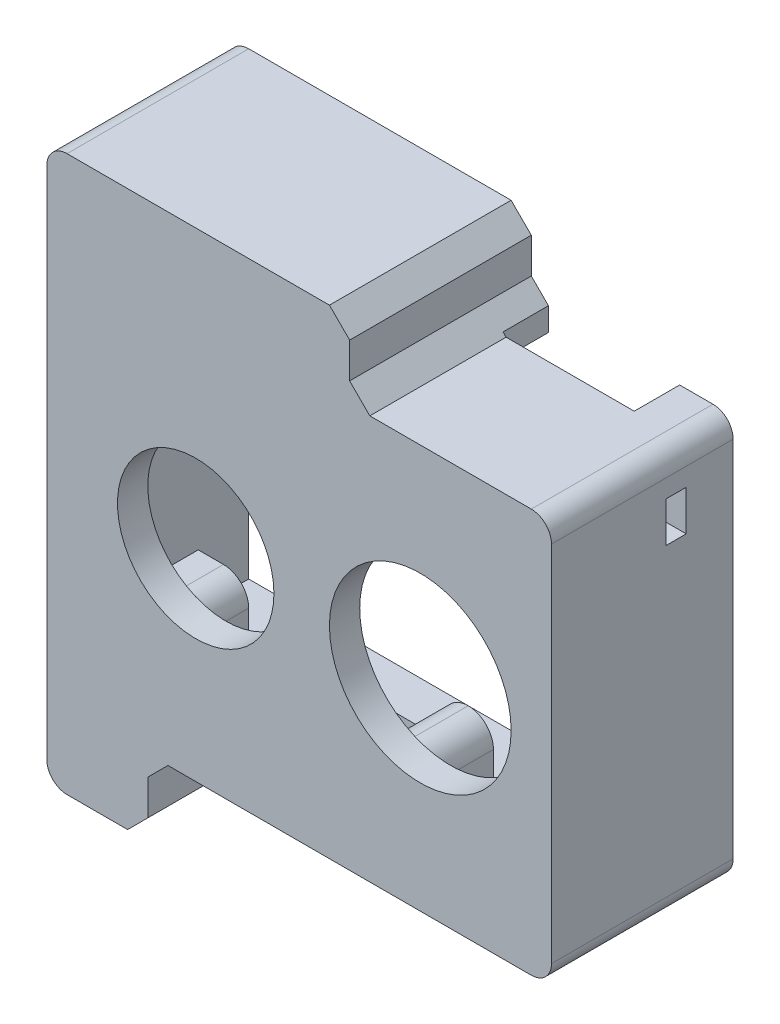
from build123d import *

# Parameters (mm, degrees)
SKETCH1_W           = 46
SKETCH1_H           = 36
BOSS_EXTRUDE1_DEPTH = 15
BOSS_EXTRUDE2_DEPTH = 3
SKETCH3_R           = 7.75
SKETCH3_R_2         = 9
CUT_EXTRUDE1_DEPTH  = 10
SKETCH4_W           = 5
SKETCH4_H           = 5
SKETCH4_R           = 1
BOSS_EXTRUDE3_DEPTH = 10
FILLET1_R           = 2.5
SKETCH6_R           = 1
CUT_EXTRUDE2_DEPTH  = 10
CHAMFER1_SIZE       = 2
FILLET2_R           = 2
SKETCH7_W           = 13
SKETCH7_H           = 4.5
CUT_EXTRUDE3_DEPTH  = 10
SKETCH8_W           = 9
SKETCH8_H           = 4
CUT_EXTRUDE4_DEPTH  = 10
SKETCH9_W           = 2
SKETCH9_H           = 4
CUT_EXTRUDE5_DEPTH  = 10


with BuildPart() as part:
    # Sketch1 → Boss-Extrude1 (new body)
    with BuildSketch(Plane.XY):
        Polygon((-15, -27.5), (-15, -20), (25, -20), (25, 20), (5, 20), (5, 27.5), (-25, 27.5), (-25, -27.5), align=None)
        Rectangle(SKETCH1_W, SKETCH1_H, mode=Mode.SUBTRACT)
    extrude(amount=BOSS_EXTRUDE1_DEPTH)

    # Sketch2 → Boss-Extrude2 (add)
    with BuildSketch(Plane.XY.offset(15)):
        Polygon((-25, 27.5), (-25, -27.5), (-15, -27.5), (-15, -20), (25, -20), (25, 20), (5, 20), (5, 27.5), align=None)
    extrude(amount=BOSS_EXTRUDE2_DEPTH)

    # Sketch3 → Cut-Extrude1 (cut)
    with BuildSketch(Plane.XY.offset(18)):
        with Locations((-10.25, 0)):
            Circle(SKETCH3_R)
        with Locations((12, 0)):
            Circle(SKETCH3_R_2)
    extrude(amount=-CUT_EXTRUDE1_DEPTH, mode=Mode.SUBTRACT)

    # Sketch4 → Boss-Extrude3 (add)
    # profile 1 of 4: a face of its own
    with BuildSketch(Plane(origin=(0, 0, 15), x_dir=(-1, 0, 0), z_dir=(0, 0, -1))):
        with Locations((20.5, -15.5)):
            Rectangle(SKETCH4_W, SKETCH4_H)
        with Locations((20.252039878, -15.196246514)):
            Circle(SKETCH4_R, mode=Mode.SUBTRACT)
    # profile 2 of 4: a face of its own
    with BuildSketch(Plane(origin=(0, 0, 15), x_dir=(-1, 0, 0), z_dir=(0, 0, -1))):
        with Locations((-3.747960122, -15.5)):
            Rectangle(SKETCH4_W, SKETCH4_H)
        with Locations((-3.747960122, -15.196246514)):
            Circle(SKETCH4_R, mode=Mode.SUBTRACT)
    # profile 3 of 4: a face of its own
    with BuildSketch(Plane(origin=(0, 0, 15), x_dir=(-1, 0, 0), z_dir=(0, 0, -1))):
        with Locations((-3.747960122, 15.5)):
            Rectangle(SKETCH4_W, SKETCH4_H)
        with Locations((-3.747960122, 15.203753486)):
            Circle(SKETCH4_R, mode=Mode.SUBTRACT)
    # profile 4 of 4: a face of its own
    with BuildSketch(Plane(origin=(0, 0, 15), x_dir=(-1, 0, 0), z_dir=(0, 0, -1))):
        with Locations((20.5, 15.5)):
            Rectangle(SKETCH4_W, SKETCH4_H)
        with Locations((20.252039878, 15.203753486)):
            Circle(SKETCH4_R, mode=Mode.SUBTRACT)
    extrude(amount=BOSS_EXTRUDE3_DEPTH)

    # Fillet1
    fillet1_edges = [part.edges().sort_by_distance(p)[0] for p in [
        (1.247960122, 13, 10),
        (6.247960122, 13, 10),
        (-18, 13, 10),
        (-18, -13, 10),
        (1.247960122, -13, 10),
        (6.247960122, -13, 10),
    ]]
    fillet(fillet1_edges, radius=FILLET1_R - 0.0001)  # a hair under: the kernel refuses the full size

    # Sketch6 → Cut-Extrude2 (cut)
    with BuildSketch(Plane(origin=(0, 0, -3), x_dir=(-1, 0, 0), z_dir=(0, 0, -1))):
        with Locations((0, 22.5)):
            Circle(SKETCH6_R)
        with Locations((20, 22.5)):
            Circle(SKETCH6_R)
        with Locations((20, -22.5)):
            Circle(SKETCH6_R)
    extrude(amount=-CUT_EXTRUDE2_DEPTH, mode=Mode.SUBTRACT)

    # Chamfer1
    chamfer1_edges = [part.edges().sort_by_distance(p)[0] for p in [
        (5, 27.5, 9),
        (5, 20, 9),
        (-15, -20, 9),
        (-15, -27.5, 9),
    ]]
    chamfer(chamfer1_edges, length=CHAMFER1_SIZE)

    # Fillet2
    fillet2_edges = [part.edges().sort_by_distance(p)[0] for p in [
        (-25, 27.5, 9),
        (25, 20, 9),
        (25, -20, 9),
        (-25, -27.5, 9),
    ]]
    fillet(fillet2_edges, radius=FILLET2_R)

    # Sketch7 → Cut-Extrude3 (cut)
    with BuildSketch(Plane.XZ.offset(-18)):
        with Locations((13.2, 2.25)):
            Rectangle(SKETCH7_W, SKETCH7_H)
    extrude(amount=-CUT_EXTRUDE3_DEPTH, mode=Mode.SUBTRACT)

    # Sketch8 → Cut-Extrude4 (cut)
    with BuildSketch(Plane(origin=(0, -18, 0), x_dir=(1, 0, 0), z_dir=(0, 1, 0))):
        Polygon((22.2, 0), (9.2, 0), (9.2, -4.5), (11.7, -4.5), (11.7, -9.5), (22.2, -9.5), align=None)
        with Locations((-3.8, -6.2)):
            Rectangle(SKETCH8_W, SKETCH8_H)
    extrude(amount=-CUT_EXTRUDE4_DEPTH, mode=Mode.SUBTRACT)

    # Sketch9 → Cut-Extrude5 (cut)
    with BuildSketch(Plane.ZY.offset(-23)):
        with Locations((5.65, 14.2)):
            Rectangle(SKETCH9_W, SKETCH9_H)
    extrude(amount=-CUT_EXTRUDE5_DEPTH, mode=Mode.SUBTRACT)


solid = part.part
